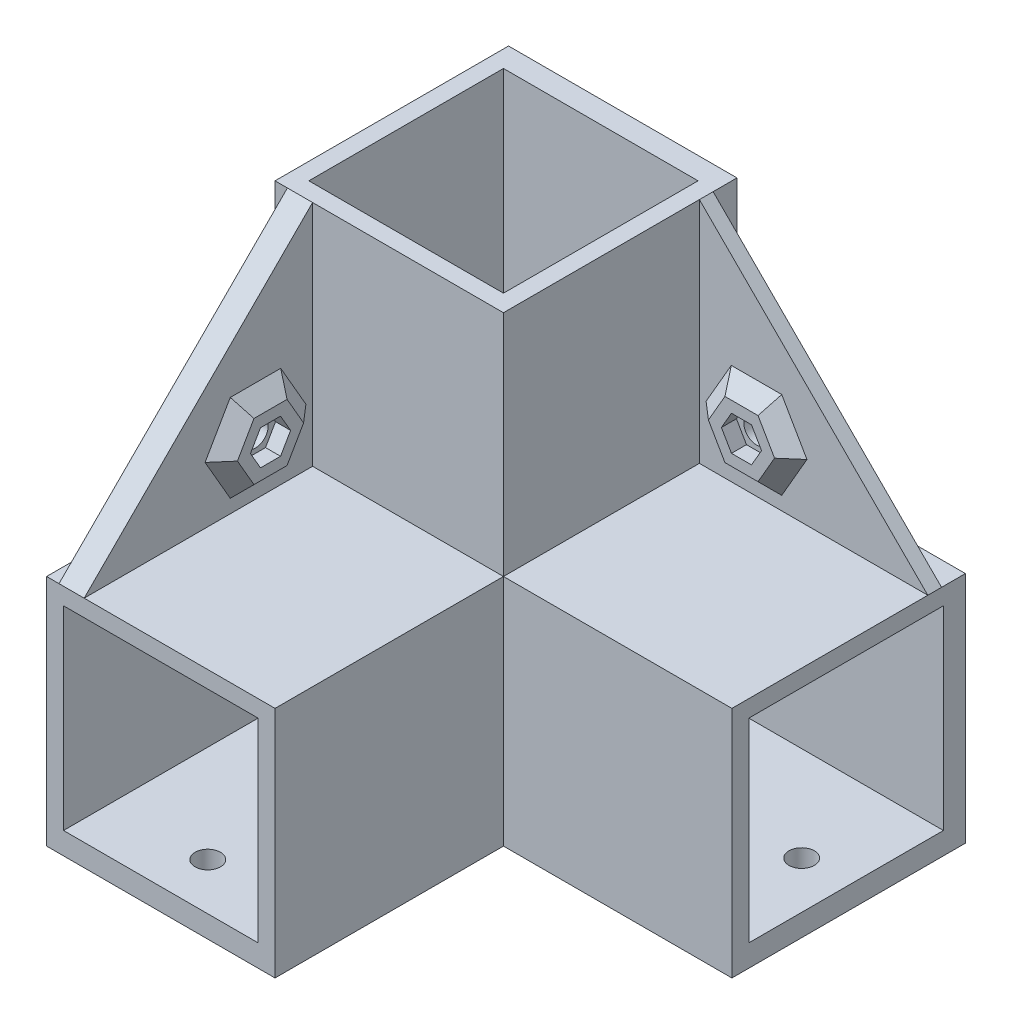
from build123d import *

# Parameters (mm, degrees)
ESQUISSE1_W                                       = 121.6
ESQUISSE1_H                                       = 121.6
BOSS_EXTRU_1_DEPTH                                = 60.8
ESQUISSE2_W                                       = 60.8
ESQUISSE2_H                                       = 60.8
ENL_V_MAT_EXTRU_1_DEPTH                           = 149.928976361
ESQUISSE3_W                                       = 60.8
ESQUISSE3_H                                       = 60.8
ENL_V_MAT_EXTRU_2_DEPTH                           = 106.3086891
ESQUISSE4_W                                       = 60.8
ESQUISSE4_H                                       = 60.8
ENL_V_MAT_EXTRU_3_DEPTH                           = 106.3086891
ESQUISSE5_W                                       = 51.8
ESQUISSE5_H                                       = 51.8
ENL_V_MAT_EXTRU_4_DEPTH                           = 60.8
ESQUISSE6_W                                       = 51.8
ESQUISSE6_H                                       = 51.8
ENL_V_MAT_EXTRU_5_DEPTH                           = 60.8
ESQUISSE7_W                                       = 51.8
ESQUISSE7_H                                       = 51.8
ENL_V_MAT_EXTRU_6_DEPTH                           = 60.8
BOSS_EXTRU_8_DEPTH                                = 1.35
FRAISAGE_POUR_VIS_T_TE_FRAIS_E_BOMB_E_D           = 4.3053
FRAISAGE_POUR_VIS_T_TE_FRAIS_E_BOMB_E_DEPTH       = 20
FRAISAGE_POUR_VIS_T_TE_FRAIS_E_BOMB_E_CSINK_D     = 7.0866
FRAISAGE_POUR_VIS_T_TE_FRAIS_E_BOMB_E_CSINK_ANGLE = 82
FRAISAGE_POUR_VIS_T_TE_FRAIS_E_BOMB_E_TIP         = 1.293442612
FRAISAGE_POUR_VIS_T_TE_FRAIS_E_6_PAN_D            = 4.3053
FRAISAGE_POUR_VIS_T_TE_FRAIS_E_6_PAN_DEPTH        = 20
FRAISAGE_POUR_VIS_T_TE_FRAIS_E_6_PAN_CSINK_D      = 7.7978
FRAISAGE_POUR_VIS_T_TE_FRAIS_E_6_PAN_CSINK_ANGLE  = 82
FRAISAGE_POUR_VIS_T_TE_FRAIS_E_6_PAN_TIP          = 1.293442612
BOSS_EXTRU_3_DEPTH                                = 10
ENL_V_MAT_EXTRU_13_DEPTH                          = 6.35
BOSS_EXTRU_2_DEPTH                                = 10
ENL_V_MAT_EXTRU_12_DEPTH                          = 3.3
D_GAGEMENT_1_42_D                                 = 6.7564
D_GAGEMENT_1_42_DEPTH                             = 20
D_GAGEMENT_1_42_TIP                               = 2.029827343
D_GAGEMENT_1_43_D                                 = 6.7564
D_GAGEMENT_1_43_DEPTH                             = 20
D_GAGEMENT_1_43_TIP                               = 2.029827343
BOSS_EXTRU_5_DEPTH                                = 4
CHANFREIN3_SIZE                                   = 4
BOSS_EXTRU_6_DEPTH                                = 4
CHANFREIN4_SIZE                                   = 4
BOSS_EXTRU_7_DEPTH                                = 1.35
D_GAGEMENT_1_44_D                                 = 6.7564
D_GAGEMENT_1_44_DEPTH                             = 20
D_GAGEMENT_1_44_TIP                               = 2.029827343
CHANFREIN1_START                                  = -108
CHANFREIN1_OUTLINE_W                              = 77
CHANFREIN1_OUTLINE_H                              = 88
CHANFREIN1_DEPTH                                  = 35.773481324


with BuildPart() as part:
    # Esquisse1 → Boss.-Extru.1 (new, symmetric)
    with BuildSketch(Plane.XY):
        Rectangle(ESQUISSE1_W, ESQUISSE1_H)
    extrude(amount=BOSS_EXTRU_1_DEPTH, both=True)

    # Esquisse2 → Enlèv. mat.-Extru.1 (cut, through all)
    with BuildSketch(Plane.XY.offset(60.8)):
        with Locations((30.4, 30.4)):
            Rectangle(ESQUISSE2_W, ESQUISSE2_H)
    extrude(amount=-ENL_V_MAT_EXTRU_1_DEPTH, mode=Mode.SUBTRACT)

    # Esquisse3 → Enlèv. mat.-Extru.2 (cut, through all)
    with BuildSketch(Plane(origin=(0, 0, 0), x_dir=(0, 0, -1), z_dir=(1, 0, 0))):
        with Locations((-30.4, 30.4)):
            Rectangle(ESQUISSE3_W, ESQUISSE3_H)
    extrude(amount=-ENL_V_MAT_EXTRU_2_DEPTH, mode=Mode.SUBTRACT)

    # Esquisse4 → Enlèv. mat.-Extru.3 (cut, through all)
    with BuildSketch(Plane(origin=(0, 0, 0), x_dir=(1, 0, 0), z_dir=(0, 1, 0))):
        with Locations((30.4, -30.4)):
            Rectangle(ESQUISSE4_W, ESQUISSE4_H)
    extrude(amount=-ENL_V_MAT_EXTRU_3_DEPTH, mode=Mode.SUBTRACT)

    # Esquisse5 → Enlèv. mat.-Extru.4 (cut)
    with BuildSketch(Plane.XY.offset(60.8)):
        with Locations((-30.4, -30.4)):
            Rectangle(ESQUISSE5_W, ESQUISSE5_H)
    extrude(amount=-ENL_V_MAT_EXTRU_4_DEPTH, mode=Mode.SUBTRACT)

    # Esquisse6 → Enlèv. mat.-Extru.5 (cut)
    with BuildSketch(Plane(origin=(60.8, 0, 0), x_dir=(0, 0, -1), z_dir=(1, 0, 0))):
        with Locations((30.4, -30.4)):
            Rectangle(ESQUISSE6_W, ESQUISSE6_H)
    extrude(amount=-ENL_V_MAT_EXTRU_5_DEPTH, mode=Mode.SUBTRACT)

    # Esquisse7 → Enlèv. mat.-Extru.6 (cut)
    with BuildSketch(Plane(origin=(0, 60.8, 0), x_dir=(1, 0, 0), z_dir=(0, 1, 0))):
        with Locations((-30.4, 30.4)):
            Rectangle(ESQUISSE7_W, ESQUISSE7_H)
    extrude(amount=-ENL_V_MAT_EXTRU_6_DEPTH, mode=Mode.SUBTRACT)

    # Esquisse40 → Boss.-Extru.8 (add)
    with BuildSketch(Plane(origin=(0, 0, -60.8), x_dir=(-1, 0, 0), z_dir=(0, 0, -1))):
        Polygon((0, 0), (-60.8, 0), (-60.8, -60.8), (60.8, -60.8), (60.8, 60.8), (0, 60.8), align=None)
    extrude(amount=BOSS_EXTRU_8_DEPTH)

    # Fraisage pour vis à tête fraisée bombée #61
    with Locations(Plane(origin=(0, 0, -62.15), x_dir=(-1, 0, 0), z_dir=(0, 0, -1))):
        with Locations((-30.4, -30.4), (30.4, 30.4)):
            CounterSinkHole(FRAISAGE_POUR_VIS_T_TE_FRAIS_E_BOMB_E_D / 2, FRAISAGE_POUR_VIS_T_TE_FRAIS_E_BOMB_E_CSINK_D / 2, depth=FRAISAGE_POUR_VIS_T_TE_FRAIS_E_BOMB_E_DEPTH, counter_sink_angle=FRAISAGE_POUR_VIS_T_TE_FRAIS_E_BOMB_E_CSINK_ANGLE)
            with Locations((0, 0, -(FRAISAGE_POUR_VIS_T_TE_FRAIS_E_BOMB_E_DEPTH + FRAISAGE_POUR_VIS_T_TE_FRAIS_E_BOMB_E_TIP / 2))):  # 118° drill point
                Cone(0, FRAISAGE_POUR_VIS_T_TE_FRAIS_E_BOMB_E_D / 2, FRAISAGE_POUR_VIS_T_TE_FRAIS_E_BOMB_E_TIP, mode=Mode.SUBTRACT)

    # Fraisage pour vis à tête fraisée à 6 pans creux #61
    with Locations(Plane.ZY.offset(60.8)):
        with Locations((30.4, -30.4), (-31.075, 30.4)):
            CounterSinkHole(FRAISAGE_POUR_VIS_T_TE_FRAIS_E_6_PAN_D / 2, FRAISAGE_POUR_VIS_T_TE_FRAIS_E_6_PAN_CSINK_D / 2, depth=FRAISAGE_POUR_VIS_T_TE_FRAIS_E_6_PAN_DEPTH, counter_sink_angle=FRAISAGE_POUR_VIS_T_TE_FRAIS_E_6_PAN_CSINK_ANGLE)
            with Locations((0, 0, -(FRAISAGE_POUR_VIS_T_TE_FRAIS_E_6_PAN_DEPTH + FRAISAGE_POUR_VIS_T_TE_FRAIS_E_6_PAN_TIP / 2))):  # 118° drill point
                Cone(0, FRAISAGE_POUR_VIS_T_TE_FRAIS_E_6_PAN_D / 2, FRAISAGE_POUR_VIS_T_TE_FRAIS_E_6_PAN_TIP, mode=Mode.SUBTRACT)

    # Esquisse21 → Boss.-Extru.3 (add)
    with BuildSketch(Plane(origin=(0, 0, -62.15), x_dir=(-1, 0, 0), z_dir=(0, 0, -1))):
        Polygon((0, 0), (-60.8, 0), (0, 60.8), align=None)
    extrude(amount=-BOSS_EXTRU_3_DEPTH)

    # Esquisse31 → Enlèv. mat.-Extru.13 (cut)
    with BuildSketch(Plane(origin=(0, 0, -62.15), x_dir=(-1, 0, 0), z_dir=(0, 0, -1))):
        Polygon((0, 60.8), (0, 0), (-60.8, 0), align=None)
    extrude(amount=-ENL_V_MAT_EXTRU_13_DEPTH, mode=Mode.SUBTRACT)

    # Esquisse17 → Boss.-Extru.2 (add)
    with BuildSketch(Plane.ZY.offset(60.8)):
        Polygon((0, 0), (60.8, 0), (0, 60.8), align=None)
    extrude(amount=-BOSS_EXTRU_2_DEPTH)

    # Esquisse26 → Enlèv. mat.-Extru.12 (cut)
    with BuildSketch(Plane.ZY.offset(60.8)):
        Polygon((0, 60.8), (0, 0), (60.8, 0), align=None)
    extrude(amount=-ENL_V_MAT_EXTRU_12_DEPTH, mode=Mode.SUBTRACT)

    # Dégagement 1/42
    with Locations(Plane.ZY.offset(57.5)):
        with Locations((15.2, 15.2)):
            Hole(D_GAGEMENT_1_42_D / 2, depth=D_GAGEMENT_1_42_DEPTH)
            with Locations((0, 0, -(D_GAGEMENT_1_42_DEPTH + D_GAGEMENT_1_42_TIP / 2))):  # 118° drill point
                Cone(0, D_GAGEMENT_1_42_D / 2, D_GAGEMENT_1_42_TIP, mode=Mode.SUBTRACT)

    # Dégagement 1/43
    with Locations(Plane(origin=(0, 0, -55.8), x_dir=(-1, 0, 0), z_dir=(0, 0, -1))):
        with Locations((-15.2, 15.2)):
            Hole(D_GAGEMENT_1_43_D / 2, depth=D_GAGEMENT_1_43_DEPTH)
            with Locations((0, 0, -(D_GAGEMENT_1_43_DEPTH + D_GAGEMENT_1_43_TIP / 2))):  # 118° drill point
                Cone(0, D_GAGEMENT_1_43_D / 2, D_GAGEMENT_1_43_TIP, mode=Mode.SUBTRACT)

    # Esquisse30 → Boss.-Extru.5 (add)
    with BuildSketch(Plane(origin=(-50.8, 0, 0), x_dir=(0, 0, -1), z_dir=(1, 0, 0))):
        Polygon((-6.395408395, 15.2), (-10.797704197, 22.825), (-19.602295803, 22.825), (-24.004591605, 15.2), (-19.602295803, 7.575), (-10.797704197, 7.575), align=None)
        Polygon((-9.85951001, 15.2), (-12.529755005, 19.825), (-17.870244995, 19.825), (-20.54048999, 15.2), (-17.870244995, 10.575), (-12.529755005, 10.575), align=None, mode=Mode.SUBTRACT)
    extrude(amount=BOSS_EXTRU_5_DEPTH)

    # Chanfrein3
    chanfrein3_edges = [part.edges().sort_by_distance(p)[0] for p in [
        (-50.8, 7.575, 15.2),
        (-50.8, 11.3875, 8.596556296),
        (-50.8, 19.0125, 8.596556296),
        (-50.8, 22.825, 15.2),
        (-50.8, 11.3875, 21.803443704),
        (-50.8, 19.0125, 21.803443704),
    ]]
    chamfer(chanfrein3_edges, length=CHANFREIN3_SIZE - 0.0001)  # a hair under: the kernel refuses the full size

    # Esquisse36 → Boss.-Extru.6 (add)
    with BuildSketch(Plane.XY.offset(-52.15)):
        Polygon((19.602295803, 22.825), (10.797704197, 22.825), (6.395408395, 15.2), (10.797704197, 7.575), (19.602295803, 7.575), (24.004591605, 15.2), align=None)
        Polygon((20.54048999, 15.2), (17.870244995, 19.825), (12.529755005, 19.825), (9.85951001, 15.2), (12.529755005, 10.575), (17.870244995, 10.575), align=None, mode=Mode.SUBTRACT)
    extrude(amount=BOSS_EXTRU_6_DEPTH)

    # Chanfrein4
    chanfrein4_edges = [part.edges().sort_by_distance(p)[0] for p in [
        (8.596556296, 11.3875, -52.15),
        (8.596556296, 19.0125, -52.15),
        (15.2, 7.575, -52.15),
        (21.803443704, 11.3875, -52.15),
        (21.803443704, 19.0125, -52.15),
        (15.2, 22.825, -52.15),
    ]]
    chamfer(chanfrein4_edges, length=CHANFREIN4_SIZE - 0.0001)  # a hair under: the kernel refuses the full size

    # Esquisse39 → Boss.-Extru.7 (add)
    with BuildSketch(Plane.XZ.offset(60.8)):
        Polygon((0, 0), (0, 60.8), (-60.8, 60.8), (-60.8, -62.15), (60.8, -62.15), (60.8, 0), align=None)
    extrude(amount=BOSS_EXTRU_7_DEPTH)

    # Dégagement 1/44
    with Locations(Plane(origin=(0, -62.15, 0), x_dir=(-1, 0, 0), z_dir=(0, -1, 0))):
        with Locations((-48.3, 31.075), (30.4, -48.3)):
            Hole(D_GAGEMENT_1_44_D / 2, depth=D_GAGEMENT_1_44_DEPTH)
            with Locations((0, 0, -(D_GAGEMENT_1_44_DEPTH + D_GAGEMENT_1_44_TIP / 2))):  # 118° drill point
                Cone(0, D_GAGEMENT_1_44_D / 2, D_GAGEMENT_1_44_TIP, mode=Mode.SUBTRACT)

    # Chanfrein1: read off the stored shape, not the designer's step
    # Chanfrein1 outline → Chanfrein1 (cut)
    with BuildSketch(Plane(origin=(0, 0, 0), x_dir=(0.816496580927726, -0.40824829046386324, -0.40824829046386263), z_dir=(0.5773502691896256, 0.5773502691896264, 0.5773502691896255)).offset(CHANFREIN1_START)):
        with Locations((13.5, 0)):
            Rectangle(CHANFREIN1_OUTLINE_W, CHANFREIN1_OUTLINE_H)
    extrude(amount=CHANFREIN1_DEPTH, mode=Mode.SUBTRACT)


solid = part.part
